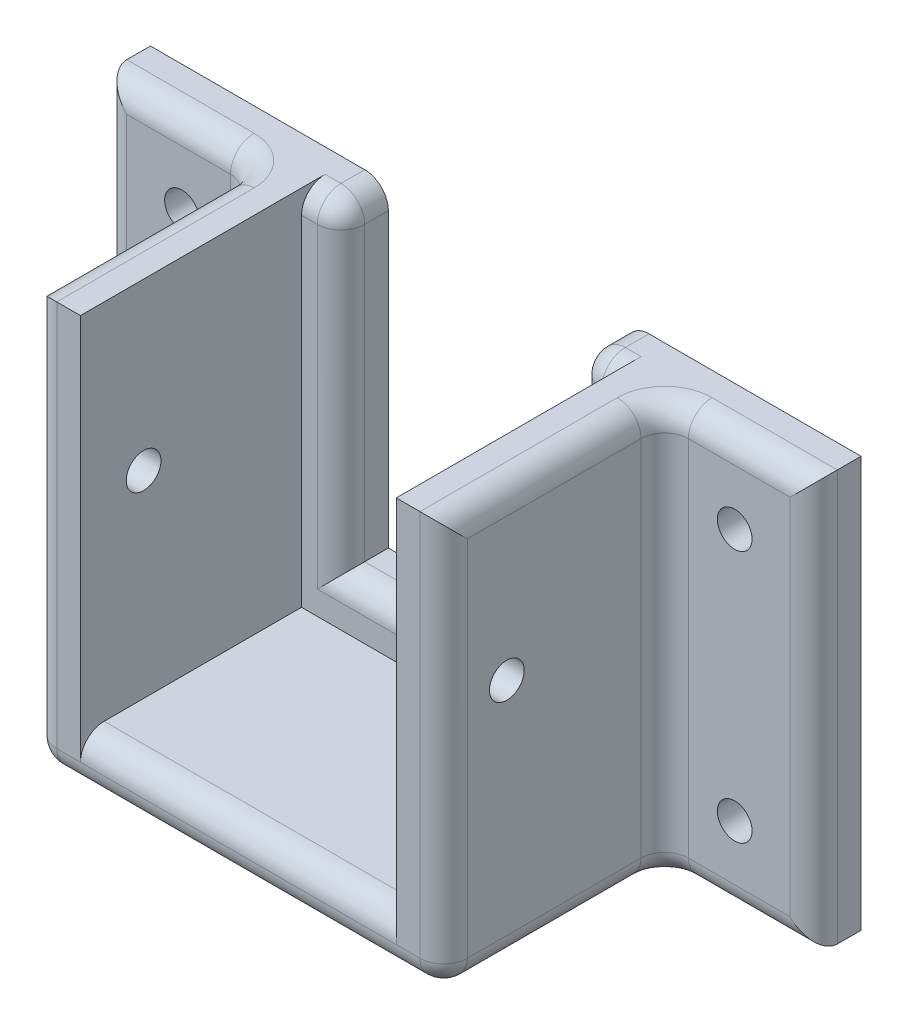
from build123d import *

# Parameters (mm, degrees)
SKETCH1_W                    = 45
SKETCH1_H                    = 26
BOSS_EXTRUDE5_DEPTH          = 3
BOSS_EXTRUDE6_DEPTH          = 14
CUT_EXTRUDE1_DEPTH           = 30.516944286
CUT_EXTRUDE1_DEPTH_BACK      = 30.516944286
SKETCH9_W                    = 15
SKETCH9_H                    = 20
M2_CLEARANCE_HOLE2_OUTLINE_R = 1.1
M2_CLEARANCE_HOLE2_DEPTH     = 3
M2_CLEARANCE_HOLE3_D         = 2.2
FILLET1_R                    = 1.5
FILLET2_R                    = 1.5


# Read off the part's stored shape, not the designer's step: M2 Clearance Hole2
with BuildPart() as part:
    # Sketch1 → Boss-Extrude5 (new body)
    with BuildSketch(Plane.XY):
        Rectangle(SKETCH1_W, SKETCH1_H)
    extrude(amount=BOSS_EXTRUDE5_DEPTH)

    # Sketch8 → Boss-Extrude6 (add)
    with BuildSketch(Plane.XY.offset(3)):
        Polygon((-9.931802589, -10), (-9.931802589, 13), (-12.931802589, 13), (-12.931802589, -13), (13.068197411, -13), (13.068197411, 13), (10.068197411, 13), (10.068197411, -10), align=None)
    extrude(amount=BOSS_EXTRUDE6_DEPTH)

    # Sketch9 → Cut-Extrude1 (cut, two sides: drawn at the far end of the back side and taken through both)
    with BuildSketch(Plane.XY.offset(3).offset(-CUT_EXTRUDE1_DEPTH_BACK)):
        with Locations((0.068197411, 3)):
            Rectangle(SKETCH9_W, SKETCH9_H)
    extrude(amount=CUT_EXTRUDE1_DEPTH + CUT_EXTRUDE1_DEPTH_BACK, mode=Mode.SUBTRACT)

    # M2 Clearance Hole2 outline → M2 Clearance Hole2 (cut)
    with BuildSketch(Plane.XY):
        with Locations((17.5, 8)):
            Circle(M2_CLEARANCE_HOLE2_OUTLINE_R)
        with Locations((-17.5, -8)):
            Circle(M2_CLEARANCE_HOLE2_OUTLINE_R)
        with Locations((-17.5, 8)):
            Circle(M2_CLEARANCE_HOLE2_OUTLINE_R)
        with Locations((17.5, -8)):
            Circle(M2_CLEARANCE_HOLE2_OUTLINE_R)
    extrude(amount=M2_CLEARANCE_HOLE2_DEPTH, mode=Mode.SUBTRACT)

    # M2 Clearance Hole3 (through all)
    with Locations(Plane.ZY.offset(12.931802589)):
        with Locations((13, 2.5)):
            Hole(M2_CLEARANCE_HOLE3_D / 2)

    # Fillet1
    fillet1_edges = [part.edges().sort_by_distance(p)[0] for p in [
        (-22.5, 0, 3),
        (-17.715901295, 13, 3),
        (17.784098705, -13, 3),
        (-17.715901295, -13, 3),
        (-12.931802589, 0, 3),
        (-12.931802589, 13, 10),
        (-12.931802589, -13, 10),
        (13.068197411, 0, 3),
        (13.068197411, -13, 10),
        (13.068197411, 13, 10),
        (-12.931802589, 0, 17),
        (0.068197411, -13, 17),
        (13.068197411, 0, 17),
        (0.068197411, -10, 17),
        (22.5, 0, 3),
        (17.784098705, 13, 3),
    ]]
    fillet(fillet1_edges, radius=FILLET1_R - 0.0001)  # a hair under: the kernel refuses the full size

    # Fillet2
    fillet2_edges = [part.edges().sort_by_distance(p)[0] for p in [
        (8.818197411, 13, 3),
        (-8.681802589, 13, 3),
        (7.568197411, 3, 3),
        (0.068197411, -7, 3),
        (-7.431802589, 3, 3),
        (-7.431802589, 13, 1.5),
        (7.568197411, 13, 1.5),
    ]]
    fillet(fillet2_edges, radius=FILLET2_R)


solid = part.part
